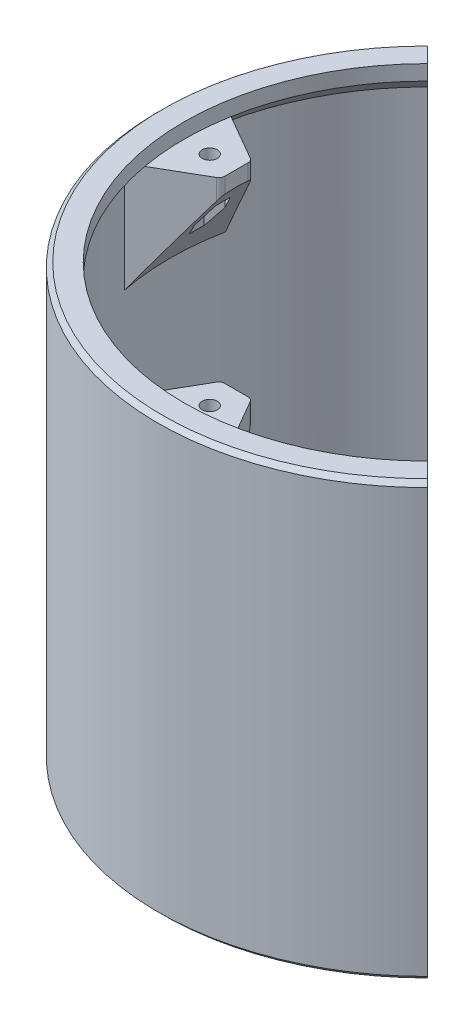
from build123d import *
from build123d.topology import SkipClean

# Parameters (mm, degrees)
SKETCH1_R           = 113.190995512
SKETCH1_R_2         = 108.19099551
BOSS_EXTRUDE1_DEPTH = 181.61
SKETCH2_R           = 108.19099551
SKETCH2_R_2         = 89.535
BOSS_EXTRUDE2_DEPTH = 6.35
BOSS_EXTRUDE3_START = -6.35
SKETCH3_R           = 3.175
BOSS_EXTRUDE3_DEPTH = 6.35
CIRPATTERN1_COUNT   = 4
BOSS_EXTRUDE4_START = -6.35
SKETCH4_R           = 108.19099551
SKETCH4_R_2         = 102.235
BOSS_EXTRUDE4_DEPTH = 6.35
CHAMFER1_SIZE       = 39.902455308
CHAMFER1_SIZE_2     = 27.94
SKETCH6_R           = 5.08
CUT_EXTRUDE1_DEPTH  = 41.172455308
CIRPATTERN3_COUNT   = 4
SKETCH7_R           = 108.19099551
SKETCH7_R_2         = 3.175
BOSS_EXTRUDE5_DEPTH = 6.35
CIRPATTERN4_COUNT   = 4
FILLET1_R           = 2.54
SKETCH9_W           = 254.360312986
SKETCH9_H           = 285.459110376
CUT_EXTRUDE2_DEPTH  = 243.087990264
CHAMFER2_SIZE       = 1.905
CUT_EXTRUDE3_DEPTH  = 41.172455308
CIRPATTERN5_COUNT   = 2
CIRPATTERN5_ANGLE   = 90
BOSS_EXTRUDE6_DEPTH = 6.35
CHAMFER3_SIZE       = 6.35


with BuildPart() as part:
    # Sketch1 → Boss-Extrude1 (new body)
    with BuildSketch(Plane(origin=(0, 0, 0), x_dir=(1, 0, 0), z_dir=(0, 1, 0))):
        with Locations(Location((0, 0, 0), (0, 0, 270))):
            Circle(SKETCH1_R)
        with Locations(Location((0, 0, 0), (0, 0, 270))):
            Circle(SKETCH1_R_2, mode=Mode.SUBTRACT)
    extrude(amount=BOSS_EXTRUDE1_DEPTH)

    # Sketch2 → Boss-Extrude2 (add)
    with BuildSketch(Plane(origin=(0, 0, 0), x_dir=(1, 0, 0), z_dir=(0, 1, 0))):
        with Locations(Location((0, 0, 0), (0, 0, 270))):
            Circle(SKETCH2_R)
        with Locations(Location((0, 0, 0), (0, 0, 270))):
            Circle(SKETCH2_R_2, mode=Mode.SUBTRACT)
    extrude(amount=BOSS_EXTRUDE2_DEPTH)

    # Sketch3 → Boss-Extrude3 (add)
    with BuildSketch(Plane(origin=(0, 175.26, 0), x_dir=(1, 0, 0), z_dir=(0, 1, 0)).offset(BOSS_EXTRUDE3_START)):
        with BuildLine():
            ThreePointArc((21.262958774, 106.080997797), (0, 108.19099551), (-21.262958774, 106.080997797))
            Line((-21.262958774, 106.080997797), (-6.35, 80.25099551))
            Line((-6.35, 80.25099551), (6.35, 80.25099551))
            Line((6.35, 80.25099551), (21.262958774, 106.080997797))
        make_face()
        with Locations(Location((0, 91.44, 0), (0, 0, 270))):
            Circle(SKETCH3_R, mode=Mode.SUBTRACT)
    boss_extrude3 = extrude(amount=BOSS_EXTRUDE3_DEPTH)

    # CirPattern1: Boss-Extrude3 ×4 about axis
    cirpattern1_axis = Axis((0, 0, 0), (0, 1, 0))
    for i in range(1, CIRPATTERN1_COUNT):
        add(boss_extrude3.rotate(cirpattern1_axis, i * 360 / CIRPATTERN1_COUNT))

    # Sketch4 → Boss-Extrude4 (add)
    with BuildSketch(Plane(origin=(0, 181.61, 0), x_dir=(1, 0, 0), z_dir=(0, 1, 0)).offset(BOSS_EXTRUDE4_START)):
        with Locations(Location((0, 0, 0), (0, 0, 101.33421434))):
            Circle(SKETCH4_R)
        with Locations(Location((0, 0, 0), (0, 0, 270))):
            Circle(SKETCH4_R_2, mode=Mode.SUBTRACT)
    extrude(amount=BOSS_EXTRUDE4_DEPTH)

    # Sketch5 → Revolve1 (revolve)
    with BuildSketch(Plane.XY, mode=Mode.PRIVATE) as revolve1_sk:
        Polygon((-108.19099551, 168.91), (-108.19099551, 175.26), (-102.235, 175.26), align=None)
    revolve(revolve1_sk.sketch.rotate(Axis((0, 0, 0), (0, 1, 0)), 281.33421434), axis=Axis((0, 0, 0), (0, 1, 0)))

    # Chamfer1
    # the kernel refuses this chamfer: 39.902455308, 27.94 mm, written as the material it adds along each edge
    with BuildSketch(Plane(origin=(0, 168.91, 0), x_dir=(0.9128976570613676, 0, -0.4081885198433021), z_dir=(0.4081885198433021, 0, 0.9128976570613676))) as chamfer1_piece_1_section:
        Polygon((108.19099551, -CHAMFER1_SIZE), (108.19099551 - CHAMFER1_SIZE_2, 0), (108.19099551, 0), align=None)
    chamfer1_piece_1 = revolve(axis=Axis((0, 168.91, 0), (0, 1, 0)), revolution_arc=131.817817718, mode=Mode.PRIVATE)
    chamfer1_piece_1 = chamfer1_piece_1 - Plane(origin=(0, 168.91, -91.44), x_dir=(0, 0, 1), z_dir=(0, -1, 0)) * Cylinder(3.175, 433, mode=Mode.PRIVATE)
    chamfer1_piece_1 = split(chamfer1_piece_1, bisect_by=Plane(origin=(-29.987200395, 168.91, -17.31311822), z_dir=(-0.8660254037844379, 0, -0.5000000000000014)), keep=Keep.TOP, mode=Mode.PRIVATE)
    chamfer1_piece_1 = split(chamfer1_piece_1, bisect_by=Plane(origin=(0, 168.91, -80.25099551), z_dir=(0, 0, -1)), keep=Keep.TOP, mode=Mode.PRIVATE)
    chamfer1_piece_1 = split(chamfer1_piece_1, bisect_by=Plane(origin=(29.987200395, 168.91, -17.31311822), z_dir=(0.866025403784438, 0, -0.500000000000001)), keep=Keep.TOP, mode=Mode.PRIVATE)
    add(chamfer1_piece_1)
    with BuildSketch(Plane(origin=(0, 168.91, 0), x_dir=(-0.4081885198433016, 0, -0.9128976570613677), z_dir=(0.9128976570613677, 0, -0.4081885198433016))) as chamfer1_piece_2_section:
        Polygon((108.19099551, -CHAMFER1_SIZE), (108.19099551 - CHAMFER1_SIZE_2, 0), (108.19099551, 0), align=None)
    chamfer1_piece_2 = revolve(axis=Axis((0, 168.91, 0), (0, 1, 0)), revolution_arc=131.817817718, mode=Mode.PRIVATE)
    chamfer1_piece_2 = chamfer1_piece_2 - Plane(origin=(-91.44, 168.91, 0), x_dir=(1, 0, 0), z_dir=(0, -1, 0)) * Cylinder(3.175, 433, mode=Mode.PRIVATE)
    chamfer1_piece_2 = split(chamfer1_piece_2, bisect_by=Plane(origin=(-17.31311822, 168.91, 29.987200395), z_dir=(-0.5000000000000016, 0, 0.8660254037844378)), keep=Keep.TOP, mode=Mode.PRIVATE)
    chamfer1_piece_2 = split(chamfer1_piece_2, bisect_by=Plane(origin=(-80.25099551, 168.91, 0), z_dir=(-1, 0, 0)), keep=Keep.TOP, mode=Mode.PRIVATE)
    chamfer1_piece_2 = split(chamfer1_piece_2, bisect_by=Plane(origin=(-17.31311822, 168.91, -29.987200395), z_dir=(-0.5000000000000009, 0, -0.8660254037844382)), keep=Keep.TOP, mode=Mode.PRIVATE)
    add(chamfer1_piece_2)
    with BuildSketch(Plane(origin=(0, 168.91, 0), x_dir=(-0.9128902278186333, 0, 0.40820513464830877), z_dir=(-0.40820513464830877, 0, -0.9128902278186333))) as chamfer1_piece_3_section:
        Polygon((108.19099551, -CHAMFER1_SIZE), (108.19099551 - CHAMFER1_SIZE_2, 0), (108.19099551, 0), align=None)
    chamfer1_piece_3 = revolve(axis=Axis((0, 168.91, 0), (0, 1, 0)), revolution_arc=65.907866067, mode=Mode.PRIVATE)
    chamfer1_piece_3 = chamfer1_piece_3 - Plane(origin=(0, 168.91, 91.44), x_dir=(0, 0, -1), z_dir=(0, -1, 0)) * Cylinder(3.175, 433, mode=Mode.PRIVATE)
    chamfer1_piece_3 = split(chamfer1_piece_3, bisect_by=Plane(origin=(29.987200395, 168.91, 17.31311822), z_dir=(0.8660254037844378, 0, 0.5000000000000016)), keep=Keep.TOP, mode=Mode.PRIVATE)
    chamfer1_piece_3 = split(chamfer1_piece_3, bisect_by=Plane(origin=(0, 168.91, 80.25099551), z_dir=(0, 0, 1)), keep=Keep.TOP, mode=Mode.PRIVATE)
    add(chamfer1_piece_3)
    with BuildSketch(Plane(origin=(0, 168.91, 0), x_dir=(0, 0, 1), z_dir=(-1, 0, 0))) as chamfer1_piece_4_section:
        Polygon((108.19099551, -CHAMFER1_SIZE), (108.19099551 - CHAMFER1_SIZE_2, 0), (108.19099551, 0), align=None)
    chamfer1_piece_4 = revolve(axis=Axis((0, 168.91, 0), (0, 1, 0)), revolution_arc=65.907866067, mode=Mode.PRIVATE)
    chamfer1_piece_4 = chamfer1_piece_4 - Plane(origin=(0, 168.91, 91.44), x_dir=(0, 0, -1), z_dir=(0, -1, 0)) * Cylinder(3.175, 433, mode=Mode.PRIVATE)
    chamfer1_piece_4 = split(chamfer1_piece_4, bisect_by=Plane(origin=(0, 168.91, 80.25099551), z_dir=(0, 0, 1)), keep=Keep.TOP, mode=Mode.PRIVATE)
    chamfer1_piece_4 = split(chamfer1_piece_4, bisect_by=Plane(origin=(-29.987200395, 168.91, 17.31311822), z_dir=(-0.8660254037844382, 0, 0.5000000000000009)), keep=Keep.TOP, mode=Mode.PRIVATE)
    add(chamfer1_piece_4)
    with BuildSketch(Plane(origin=(0, 168.91, 0), x_dir=(0.40818851984330157, 0, 0.9128976570613677), z_dir=(-0.9128976570613677, 0, 0.40818851984330157))) as chamfer1_piece_5_section:
        Polygon((108.19099551 - CHAMFER1_SIZE_2, 0), (108.19099551, -CHAMFER1_SIZE), (108.19099551, 0), align=None)
    chamfer1_piece_5 = revolve(axis=Axis((0, 168.91, 0), (0, 1, 0)), revolution_arc=131.817817718, mode=Mode.PRIVATE)
    chamfer1_piece_5 = split(chamfer1_piece_5, bisect_by=Plane(origin=(17.31311822, 168.91, -29.987200395), z_dir=(0.5000000000000017, 0, -0.8660254037844378)), keep=Keep.TOP, mode=Mode.PRIVATE)
    chamfer1_piece_5 = split(chamfer1_piece_5, bisect_by=Plane(origin=(80.25099551, 168.91, 0), z_dir=(1, 0, 0)), keep=Keep.TOP, mode=Mode.PRIVATE)
    chamfer1_piece_5 = split(chamfer1_piece_5, bisect_by=Plane(origin=(17.31311822, 168.91, 29.987200395), z_dir=(0.5000000000000009, 0, 0.8660254037844383)), keep=Keep.TOP, mode=Mode.PRIVATE)
    chamfer1_piece_5 = chamfer1_piece_5 - Plane(origin=(91.44, 168.91, 0), x_dir=(-1, 0, 0), z_dir=(0, -1, 0)) * Cylinder(3.175, 433, mode=Mode.PRIVATE)
    add(chamfer1_piece_5)

    # Sketch6 → Cut-Extrude1 (cut)
    with BuildSketch(Plane(origin=(0, 129.007544692, 0), x_dir=(-1, 0, 0), z_dir=(0, -1, 0))):
        with Locations(Location((91.44, 0, 0), (0, 0, 38.037570002))):
            Circle(SKETCH6_R)
    cut_extrude1 = extrude(amount=-CUT_EXTRUDE1_DEPTH, mode=Mode.SUBTRACT)

    # CirPattern3: Cut-Extrude1 ×4 about axis
    cirpattern3_axis = Axis((0, 0, 0), (0, 1, 0))
    for i in range(1, CIRPATTERN3_COUNT):
        add(cut_extrude1.rotate(cirpattern3_axis, i * 360 / CIRPATTERN3_COUNT), mode=Mode.SUBTRACT)

    # Sketch7 → Boss-Extrude5 (add)
    with SkipClean():  # the faces are left unmerged after this step: merging them gives an invalid solid
        with BuildSketch(Plane(origin=(0, 6.35, 0), x_dir=(1, 0, 0), z_dir=(0, 1, 0))):
            with Locations(Location((0, 0, 0), (0, 0, 101.33421434))):
                Circle(SKETCH7_R)
            with BuildLine():
                Line((-32.086474363, 83.588123486), (-25.032001276, 65.210592791))
                ThreePointArc((-25.032001276, 65.210592791), (-18.0785103, 67.469918966), (-10.926947383, 68.990030591))
                Line((-10.926947383, 68.990030591), (-14.006359827, 88.432675575))
                ThreePointArc((-14.006359827, 88.432675575), (0, 89.535), (14.006359827, 88.432675575))
                Line((14.006359827, 88.432675575), (10.926947383, 68.990030591))
                ThreePointArc((10.926947383, 68.990030591), (18.0785103, 67.469918966), (25.032001276, 65.210592791))
                Line((25.032001276, 65.210592791), (32.086474363, 83.588123486))
                ThreePointArc((32.086474363, 83.588123486), (65.690020263, 60.838618187), (85.79964081, 25.591753788))
                ThreePointArc((85.79964081, 25.591753788), (91.391072054, 24.488163952), (87.100545471, 20.736711497))
                ThreePointArc((87.100545471, 20.736711497), (88.769015663, 11.68666262), (89.499722222, 2.513154819))
                ThreePointArc((89.499722222, 2.513154819), (94.615, 0), (89.499722222, -2.513154819))
                ThreePointArc((89.499722222, -2.513154819), (88.769015663, -11.68666262), (87.100545471, -20.736711497))
                ThreePointArc((87.100545471, -20.736711497), (91.391072054, -24.488163952), (85.79964081, -25.591753788))
                ThreePointArc((85.79964081, -25.591753788), (63.310805654, -63.310805654), (25.591753788, -85.79964081))
                ThreePointArc((25.591753788, -85.79964081), (24.488163952, -91.391072054), (20.736711497, -87.100545471))
                ThreePointArc((20.736711497, -87.100545471), (11.68666262, -88.769015663), (2.513154819, -89.499722222))
                ThreePointArc((2.513154819, -89.499722222), (0, -94.615), (-2.513154819, -89.499722222))
                ThreePointArc((-2.513154819, -89.499722222), (-11.68666262, -88.769015663), (-20.736711497, -87.100545471))
                ThreePointArc((-20.736711497, -87.100545471), (-24.488163952, -91.391072054), (-25.591753788, -85.79964081))
                ThreePointArc((-25.591753788, -85.79964081), (-63.310805654, -63.310805654), (-85.79964081, -25.591753788))
                ThreePointArc((-85.79964081, -25.591753788), (-91.391072054, -24.488163952), (-87.100545471, -20.736711497))
                ThreePointArc((-87.100545471, -20.736711497), (-88.769015663, -11.68666262), (-89.499722222, -2.513154819))
                ThreePointArc((-89.499722222, -2.513154819), (-94.615, 0), (-89.499722222, 2.513154819))
                ThreePointArc((-89.499722222, 2.513154819), (-88.769015663, 11.68666262), (-87.100545471, 20.736711497))
                ThreePointArc((-87.100545471, 20.736711497), (-91.391072054, 24.488163952), (-85.79964081, 25.591753788))
                ThreePointArc((-85.79964081, 25.591753788), (-65.690020263, 60.838618187), (-32.086474363, 83.588123486))
            make_face(mode=Mode.SUBTRACT)
            with Locations(Location((-20.543761705, 76.670362462, 0), (0, 0, 270))):
                Circle(SKETCH7_R_2, mode=Mode.SUBTRACT)
            with Locations(Location((20.543761705, 76.670362462, 0), (0, 0, 270))):
                Circle(SKETCH7_R_2, mode=Mode.SUBTRACT)
        boss_extrude5 = extrude(amount=BOSS_EXTRUDE5_DEPTH)

    # CirPattern4: Boss-Extrude5 ×4 about axis
    with SkipClean():  # the faces are left unmerged after this step: merging them gives an invalid solid
        cirpattern4_axis = Axis((0, 0, 0), (0, 1, 0))
        for i in range(1, CIRPATTERN4_COUNT):
            add(boss_extrude5.rotate(cirpattern4_axis, i * 360 / CIRPATTERN4_COUNT))

    # Fillet1
    fillet1_edges = [part.edges().sort_by_distance(p)[0] for p in [
        (65.210592791, 9.525, 25.032001276),
        (68.990030591, 9.525, 10.926947383),
        (68.990030591, 9.525, -10.926947383),
        (65.210592791, 9.525, -25.032001276),
        (25.032001276, 9.525, 65.210592791),
        (10.926947383, 9.525, 68.990030591),
        (-25.032001276, 9.525, 65.210592791),
        (-10.926947383, 9.525, 68.990030591),
        (-65.210592791, 9.525, 25.032001276),
        (-68.990030591, 9.525, 10.926947383),
        (-68.990030591, 9.525, -10.926947383),
        (-65.210592791, 9.525, -25.032001276),
        (10.926947383, 9.525, -68.990030591),
        (25.032001276, 9.525, -65.210592791),
        (-10.926947383, 9.525, -68.990030591),
        (-25.032001276, 9.525, -65.210592791),
        (80.25099551, 172.085, -6.35),
        (80.25099551, 172.085, 6.35),
        (-6.35, 172.085, -80.25099551),
        (6.35, 172.085, -80.25099551),
        (6.35, 172.085, 80.25099551),
        (-6.35, 172.085, 80.25099551),
        (-80.25099551, 172.085, -6.35),
        (-80.25099551, 172.085, 6.35),
    ]]
    fillet(fillet1_edges, radius=FILLET1_R)

    # Sketch9 → Cut-Extrude2 (cut, through all)
    with BuildSketch(Plane(origin=(0, 0, 0), x_dir=(0, -1, 0), z_dir=(-0.7071067811865488, 0, 0.7071067811865464))):
        with Locations((-89.364161155, 3.791575825)):
            Rectangle(SKETCH9_W, SKETCH9_H)
    extrude(amount=-CUT_EXTRUDE2_DEPTH, mode=Mode.SUBTRACT)

    # Chamfer2
    chamfer2_edges = [part.edges().sort_by_distance(p)[0] for p in [
        (-80.038120496, 0, 80.038120496),
        (-80.038120496, 181.61, 80.038120496),
    ]]
    chamfer(chamfer2_edges, length=CHAMFER2_SIZE)

    # Sketch10 → Cut-Extrude3 (cut)
    with BuildSketch(Plane(origin=(0, 129.007544692, 0), x_dir=(-1, 0, 0), z_dir=(0, -1, 0))):
        Polygon((96.94, 3.175426481), (91.44, 6.350852961), (85.94, 3.175426481), (85.94, -3.175426481), (91.44, -6.350852961), (96.94, -3.175426481), align=None)
    cut_extrude3 = extrude(amount=-CUT_EXTRUDE3_DEPTH, mode=Mode.SUBTRACT)

    # CirPattern5: Cut-Extrude3 ×2 about axis
    cirpattern5_axis = Axis((0, 0, 0), (0, 1, 0))
    for i in range(1, CIRPATTERN5_COUNT):
        add(cut_extrude3.rotate(cirpattern5_axis, i * CIRPATTERN5_ANGLE / (CIRPATTERN5_COUNT - 1)), mode=Mode.SUBTRACT)

    # Boss-Extrude6: read off the stored shape, not the designer's step
    # Boss-Extrude6 outline → Boss-Extrude6 (add)
    # profile 1 of 4: a face of its own
    with BuildSketch(Plane(origin=(0, 12.7, 0), x_dir=(1, 0, 0), z_dir=(0, 1, 0))):
        with BuildLine():
            ThreePointArc((-71.454732642, 11.317317838), (-69.600700891, 11.745262847), (-68.564147378, 13.340921794))
            ThreePointArc((-68.564147378, 13.340921794), (-67.469918966, 18.0785103), (-66.048754315, 22.728496505))
            ThreePointArc((-66.048754315, 22.728496505), (-66.148606516, 24.628654447), (-67.540272608, 25.926281571))
            Line((-67.540272608, 25.926281571), (-83.588123486, 32.086474363))
            ThreePointArc((-83.588123486, 32.086474363), (-86.484168857, 23.173363203), (-88.432675575, 14.006359827))
            Line((-88.432675575, 14.006359827), (-71.454732642, 11.317317838))
        make_face()
        Polygon((-75.026640763, 26.678214599), (-70.535909568, 22.187483404), (-72.179631267, 16.05303051), (-78.314084161, 14.409308811), (-82.804815356, 18.900040006), (-81.161093657, 25.0344929), align=None, mode=Mode.SUBTRACT)
    # profile 2 of 4: a face of its own
    with BuildSketch(Plane(origin=(0, 12.7, 0), x_dir=(1, 0, 0), z_dir=(0, 1, 0))):
        with BuildLine():
            ThreePointArc((-67.540272608, -25.926281571), (-66.148606516, -24.628654447), (-66.048754315, -22.728496505))
            ThreePointArc((-66.048754315, -22.728496505), (-67.469918966, -18.0785103), (-68.564147378, -13.340921794))
            ThreePointArc((-68.564147378, -13.340921794), (-69.600700891, -11.745262847), (-71.454732642, -11.317317838))
            Line((-71.454732642, -11.317317838), (-88.432675575, -14.006359827))
            ThreePointArc((-88.432675575, -14.006359827), (-86.484168857, -23.173363203), (-83.588123486, -32.086474363))
            Line((-83.588123486, -32.086474363), (-67.540272608, -25.926281571))
        make_face()
        Polygon((-78.314084161, -14.409308811), (-72.179631267, -16.05303051), (-70.535909568, -22.187483404), (-75.026640763, -26.678214599), (-81.161093657, -25.0344929), (-82.804815356, -18.900040006), align=None, mode=Mode.SUBTRACT)
    # profile 3 of 4: a face of its own
    with BuildSketch(Plane(origin=(0, 12.7, 0), x_dir=(1, 0, 0), z_dir=(0, 1, 0))):
        with BuildLine():
            ThreePointArc((-11.317317838, -71.454732642), (-11.745262847, -69.600700891), (-13.340921794, -68.564147378))
            ThreePointArc((-13.340921794, -68.564147378), (-18.0785103, -67.469918966), (-22.728496505, -66.048754315))
            ThreePointArc((-22.728496505, -66.048754315), (-24.628654447, -66.148606516), (-25.926281571, -67.540272608))
            Line((-25.926281571, -67.540272608), (-32.086474363, -83.588123486))
            ThreePointArc((-32.086474363, -83.588123486), (-23.173363203, -86.484168857), (-14.006359827, -88.432675575))
            Line((-14.006359827, -88.432675575), (-11.317317838, -71.454732642))
        make_face()
        Polygon((-26.678214599, -75.026640763), (-22.187483404, -70.535909568), (-16.05303051, -72.179631267), (-14.409308811, -78.314084161), (-18.900040006, -82.804815356), (-25.0344929, -81.161093657), align=None, mode=Mode.SUBTRACT)
    # profile 4 of 4: a face of its own
    with BuildSketch(Plane(origin=(0, 12.7, 0), x_dir=(1, 0, 0), z_dir=(0, 1, 0))):
        with BuildLine():
            ThreePointArc((25.926281571, -67.540272608), (24.628654447, -66.148606516), (22.728496505, -66.048754315))
            ThreePointArc((22.728496505, -66.048754315), (18.0785103, -67.469918966), (13.340921794, -68.564147378))
            ThreePointArc((13.340921794, -68.564147378), (11.745262847, -69.600700891), (11.317317838, -71.454732642))
            Line((11.317317838, -71.454732642), (14.006359827, -88.432675575))
            ThreePointArc((14.006359827, -88.432675575), (23.173363203, -86.484168857), (32.086474363, -83.588123486))
            Line((32.086474363, -83.588123486), (25.926281571, -67.540272608))
        make_face()
        Polygon((25.0344929, -81.161093657), (18.900040006, -82.804815356), (14.409308811, -78.314084161), (16.05303051, -72.179631267), (22.187483404, -70.535909568), (26.678214599, -75.026640763), align=None, mode=Mode.SUBTRACT)
    extrude(amount=BOSS_EXTRUDE6_DEPTH)

    # Chamfer3
    # the kernel refuses this chamfer: 6.35 mm, written as the material it adds along each edge
    with BuildSketch(Plane(origin=(1.8e-08, 12.7, 6.6e-08), x_dir=(0.1564344649574162, 0, 0.9876883406082543), z_dir=(-0.9876883406082543, 0, 0.1564344649574162))) as chamfer3_piece_1:
        Polygon((89.534999932 + CHAMFER3_SIZE, 0), (89.534999932, CHAMFER3_SIZE), (89.534999932, 0), align=None)
    revolve(axis=Axis((1.8e-08, 12.7, 6.6e-08), (0, 1, 0)), revolution_arc=12.00000001)
    with BuildSketch(Plane(origin=(-1.8e-08, 12.7, 6.6e-08), x_dir=(-0.3583679496251778, 0, 0.9335804264665397), z_dir=(-0.9335804264665397, 0, -0.3583679496251778))) as chamfer3_piece_2:
        Polygon((89.534999932 + CHAMFER3_SIZE, 0), (89.534999932, CHAMFER3_SIZE), (89.534999932, 0), align=None)
    revolve(axis=Axis((-1.8e-08, 12.7, 6.6e-08), (0, 1, 0)), revolution_arc=12.00000001)
    with BuildSketch(Plane(origin=(-6.6e-08, 12.7, 1.8e-08), x_dir=(-0.9876883406082543, 0, 0.1564344649574162), z_dir=(-0.1564344649574162, 0, -0.9876883406082543))) as chamfer3_piece_3:
        Polygon((89.534999932 + CHAMFER3_SIZE, 0), (89.534999932, CHAMFER3_SIZE), (89.534999932, 0), align=None)
    revolve(axis=Axis((-6.6e-08, 12.7, 1.8e-08), (0, 1, 0)), revolution_arc=12.00000001)
    with BuildSketch(Plane(origin=(-6.6e-08, 12.7, -1.8e-08), x_dir=(-0.9335804264665397, 0, -0.3583679496251778), z_dir=(0.3583679496251778, 0, -0.9335804264665397))) as chamfer3_piece_4:
        Polygon((89.534999932 + CHAMFER3_SIZE, 0), (89.534999932, CHAMFER3_SIZE), (89.534999932, 0), align=None)
    revolve(axis=Axis((-6.6e-08, 12.7, -1.8e-08), (0, 1, 0)), revolution_arc=12.00000001)


solid = part.part
